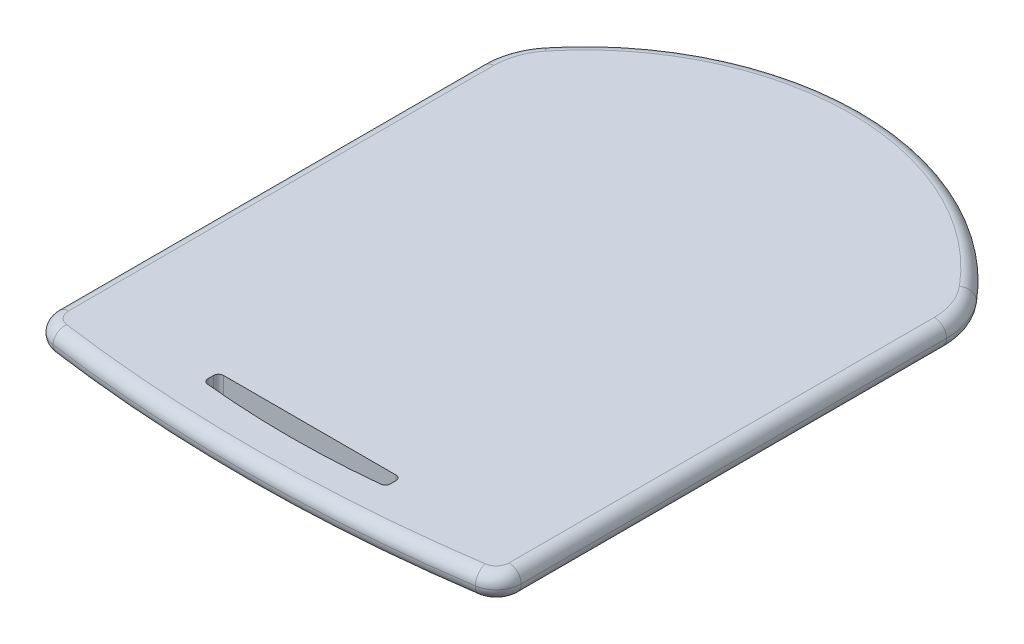
from build123d import *

# Parameters (mm, degrees)
BOSS_EXTRUDE1_DEPTH = 10
FILLET1_R           = 5


with BuildPart() as part:
    # Sketch1 → Boss-Extrude1 (new body)
    with BuildSketch(Plane(origin=(0, 0, 0), x_dir=(1, 0, 0), z_dir=(0, 1, 0))):
        with BuildLine():
            Line((95.064475679, -66.893222563), (95.064480767, 108.106777437))
            ThreePointArc((95.064480767, 108.106777437), (93.254744528, 118.406620299), (88.04232554, 127.472633565))
            ThreePointArc((88.04232554, 127.472633565), (-0.544574451, 168.543910176), (-88.562996968, 126.268078898))
            ThreePointArc((-88.562996968, 126.268078898), (-93.583004489, 117.32624486), (-95.323148669, 107.220366882))
            Line((-95.323148669, 107.220366882), (-95.323030776, -67.779633118))
            ThreePointArc((-95.323030776, -67.779633118), (-92.800151785, -74.512215926), (-86.474089698, -77.92887045))
            ThreePointArc((-86.474089698, -77.92887045), (-0.044332377, -83.617951425), (86.321358486, -77.027349436))
            ThreePointArc((86.321358486, -77.027349436), (92.576619033, -73.585431127), (95.064475679, -66.893222563))
        make_face()
        with BuildLine():
            Line((35.5, -58.821440939), (-35.5, -58.821440939))
            ThreePointArc((-35.5, -58.821440939), (-36.914213562, -59.407227376), (-37.5, -60.821440939))
            Line((-37.5, -60.821440939), (-37.5, -63.222008463))
            ThreePointArc((-37.5, -63.222008463), (-36.98495569, -64.561749706), (-35.705093402, -65.211464845))
            ThreePointArc((-35.705093402, -65.211464845), (0, -67.047022968), (35.705093402, -65.211464845))
            ThreePointArc((35.705093402, -65.211464845), (36.98495569, -64.561749706), (37.5, -63.222008463))
            Line((37.5, -63.222008463), (37.5, -60.821440939))
            ThreePointArc((37.5, -60.821440939), (36.914213562, -59.407227376), (35.5, -58.821440939))
        make_face(mode=Mode.SUBTRACT)
    extrude(amount=BOSS_EXTRUDE1_DEPTH)

    # Fillet1
    fillet1_edges = [part.edges().sort_by_distance(p)[0] for p in [
        (92.576619033, 10, 73.585431127),
        (-0.044332377, 10, 83.617951425),
        (-92.800151785, 10, 74.512215926),
        (-95.323089722, 10, -19.720366882),
        (-93.583004489, 10, -117.32624486),
        (-0.544574451, 10, -168.543910176),
        (93.254744528, 10, -118.406620299),
        (92.576619033, 0, 73.585431127),
        (-0.044332377, 0, 83.617951425),
        (-92.800151785, 0, 74.512215926),
        (-95.323089722, 0, -19.720366882),
        (-93.583004489, 0, -117.32624486),
        (-0.544574451, 0, -168.543910176),
        (93.254744528, 0, -118.406620299),
        (95.064478223, 10, -20.606777437),
        (95.064478223, 0, -20.606777437),
    ]]
    fillet(fillet1_edges, radius=FILLET1_R - 0.0001)  # a hair under: the kernel refuses the full size


solid = part.part
